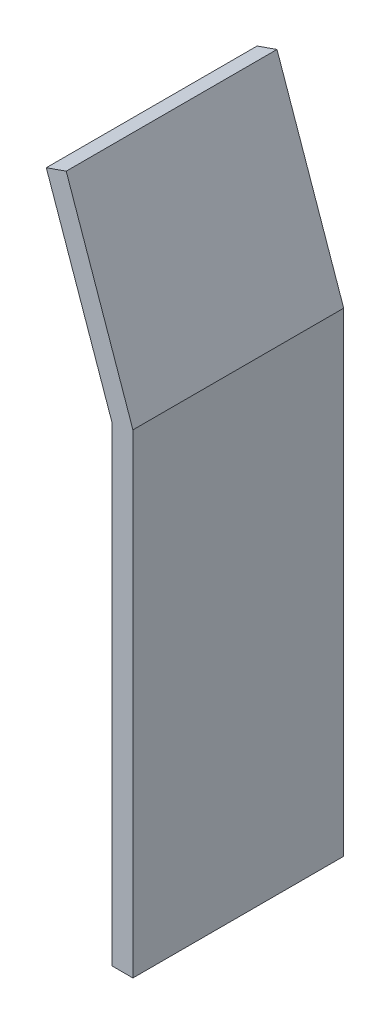
from build123d import *

# Parameters (mm, degrees)
BOSS_EXTRUDE1_DEPTH = 200


with BuildPart() as part:
    # Sketch1 → Boss-Extrude1 (new body)
    with BuildSketch(Plane.XY):
        Polygon((0, 0), (0, -447), (20, -447), (20, 3.397110563), (-43.292194013, 184.333692082), (-62.170519322, 177.729993606), align=None)
    extrude(amount=BOSS_EXTRUDE1_DEPTH)


solid = part.part
